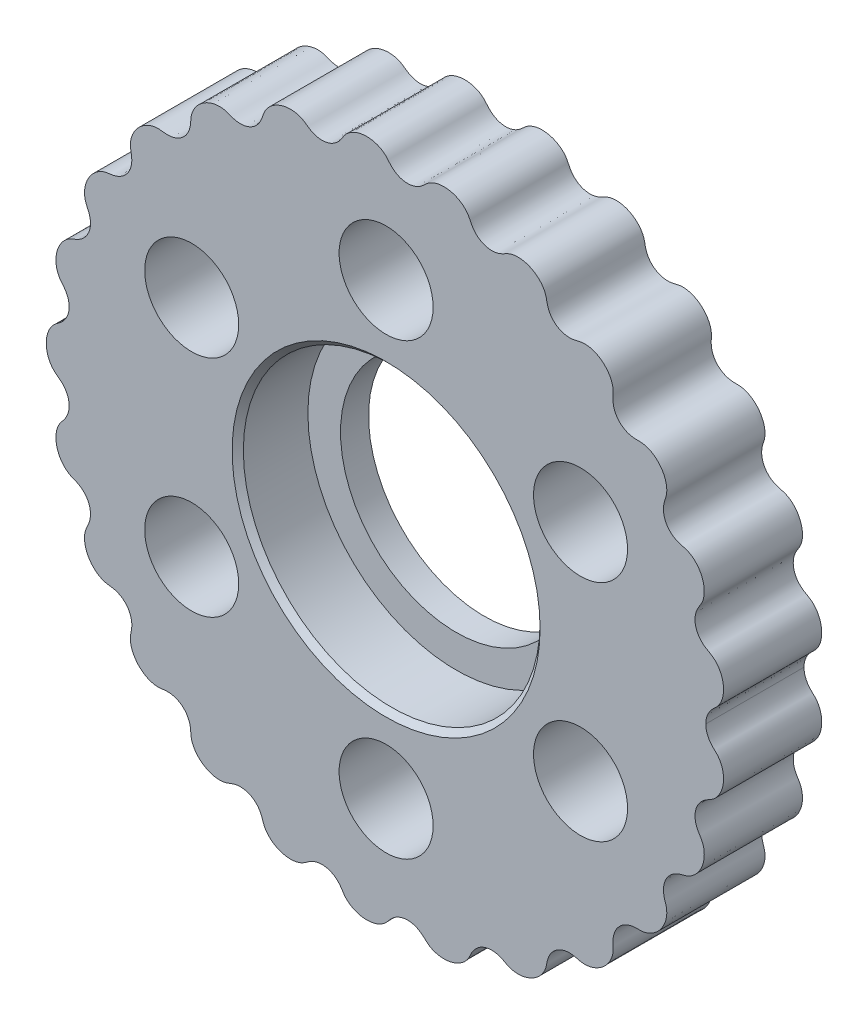
from build123d import *

# Parameters (mm, degrees)
BOSS_EXTRUDE2_OUTLINE_R   = 3.35
BOSS_EXTRUDE2_OUTLINE_R_2 = 8.25
BOSS_EXTRUDE2_DEPTH       = 7
SKETCH3_R                 = 10.575
CUT_EXTRUDE1_DEPTH        = 5
CHAMFER1_SIZE             = 0.4


# Read off the part's stored shape, not the designer's step: Boss-Extrude2
with BuildPart() as part:
    # Boss-Extrude2 outline → Boss-Extrude2 (new body)
    with BuildSketch(Plane.XY):
        with BuildLine():
            add(Edge.make_bspline(
                [(-24.22, 0), (-24.22, -0.018549196), (-24.219447299, -0.055631093), (-24.216960054, -0.12081441), (-24.210325897, -0.213487932), (-24.197882321, -0.323999799), (-24.176299834, -0.448982193), (-24.141395786, -0.595895603), (-24.088097077, -0.760122302), (-24.021284653, -0.918911553), (-23.94083921, -1.071476253), (-23.850156372, -1.210449232), (-23.750782771, -1.335175792), (-23.644418658, -1.445156499), (-23.532877519, -1.540026346), (-23.414565779, -1.626138769), (-23.295742191, -1.711436542), (-23.152646986, -1.82541348), (-22.967845238, -2.00358463), (-22.770766979, -2.270831102), (-22.61467742, -2.646713727), (-22.562902109, -3.087016939), (-22.626971537, -3.487565417), (-22.754815757, -3.791453025), (-22.891097081, -4.006933416), (-23.001901076, -4.151043768), (-23.095543837, -4.262219923), (-23.187445569, -4.374975056), (-23.269946813, -4.494784084), (-23.406247867, -4.740164684), (-23.53300629, -5.139768536), (-23.561700117, -5.698191268), (-23.386758438, -6.370571851), (-23.08963931, -6.844663095), (-22.783232826, -7.131342999), (-22.513168869, -7.298248762), (-22.313162523, -7.386218135), (-22.073134472, -7.471500821), (-21.778048031, -7.628259898), (-21.485035026, -7.865958292), (-21.237485622, -8.200285268), (-21.080759868, -8.62358006), (-21.049802486, -9.030968373), (-21.10243357, -9.354111964), (-21.183212319, -9.594182109), (-21.255573883, -9.75945739), (-21.318445407, -9.889381057), (-21.377949252, -10.020968458), (-21.426108106, -10.157164339), (-21.493710602, -10.427539308), (-21.513763193, -10.843420478), (-21.399915455, -11.390295219), (-21.102267605, -11.921886845), (-20.739385996, -12.297765819), (-20.415144238, -12.507692145), (-20.187923445, -12.608393522), (-19.997598517, -12.663680464), (-19.851881049, -12.690844938), (-19.704782383, -12.708389621), (-19.557874768, -12.727166257), (-19.375798661, -12.761217219), (-19.12514698, -12.834376848), (-18.821392565, -12.983928801), (-18.504883804, -13.253142477), (-18.255677763, -13.631335911), (-18.133312589, -14.023313646), (-18.110968987, -14.38890418), (-18.150097941, -14.710357198), (-18.216222015, -14.985193283), (-18.236712715, -15.281724635), (-18.197714574, -15.589639034), (-18.079407169, -15.979423518), (-17.869747332, -16.35091051), (-17.588251709, -16.675151517), (-17.245174502, -16.936765712), (-16.93557318, -17.10184519), (-16.649505418, -17.195443205), (-16.402439494, -17.234569713), (-16.203020578, -17.238662266), (-16.054339482, -17.227081449), (-15.906658236, -17.206886615), (-15.75867165, -17.189257805), (-15.572570565, -17.178637046), (-15.309989239, -17.1903718), (-14.977339407, -17.264917246), (-14.609384419, -17.451766877), (-14.284470124, -17.754814286), (-14.075231513, -18.097537161), (-13.964820751, -18.437303989), (-13.921748971, -18.754956982), (-13.917697603, -19.039689384), (-13.864404565, -19.334240426), (-13.749434711, -19.624864832), (-13.536523355, -19.975209385), (-13.240132232, -20.282910695), (-12.88771773, -20.525640252), (-12.493535044, -20.692228457), (-12.158712678, -20.774525308), (-11.862323107, -20.795520407), (-11.614686672, -20.774204172), (-11.419415062, -20.730290527), (-11.275199236, -20.682153953), (-11.134451159, -20.624861714), (-10.992971305, -20.569653368), (-10.811872967, -20.511706104), (-10.549107659, -20.456700486), (-10.199715261, -20.447491826), (-9.687556794, -20.567355209), (-9.25037612, -20.866339464), (-8.968827339, -21.252640531), (-8.814695671, -21.647404154), (-8.739465668, -21.920231231), (-8.611721283, -22.188801487), (-8.42738688, -22.438434035), (-8.133949594, -22.720870574), (-7.770071853, -22.943127422), (-7.366221207, -23.089260936), (-6.939032338, -23.150661023), (-6.587869488, -23.143846389), (-6.292381178, -23.085836661), (-6.057739899, -22.999115679), (-5.882069033, -22.905084999), (-5.758332763, -22.822538888), (-5.639078076, -22.733742645), (-5.517851091, -22.64774948), (-5.359585734, -22.549960212), (-5.118319749, -22.433035532), (-4.778223472, -22.33872334), (-4.244654046, -22.333064891), (-3.743968072, -22.525473928), (-3.380994126, -22.837472428), (-3.141942745, -23.180994421), (-3.005014863, -23.416642838), (-2.817421884, -23.63777599), (-2.580133042, -23.830851932), (-2.225963667, -24.030840774), (-1.747814609, -24.176595657), (-1.251961822, -24.202098476), (-0.771687178, -24.109125397), (-0.414489924, -23.958870166), (-0.161771104, -23.800119537), (0.050781503, -23.604208696), (0.218769388, -23.382667303), (0.498394334, -23.077063686), (0.893761638, -22.818281334), (1.407028151, -22.690961221), (1.92871029, -22.758151519), (2.256288171, -22.892453356), (2.482604783, -23.037782528), (2.628380604, -23.154295335), (2.738552876, -23.254753519), (2.845991601, -23.358186274), (2.958265856, -23.456441637), (3.120637218, -23.57299944), (3.342765564, -23.689815649), (3.629235302, -23.785703254), (3.977788991, -23.837563944), (4.409572456, -23.831034145), (4.82850544, -23.737573531), (5.216871718, -23.563921395), (5.543216012, -23.32245651), (5.757454793, -23.099530667), (5.919135345, -22.850999627), (6.02803793, -22.590749943), (6.22752105, -22.218605364), (6.553636474, -21.867329577), (7.02701751, -21.620425793), (7.552862402, -21.563982853), (7.900603849, -21.617256944), (8.1533003, -21.704275106), (8.321673277, -21.782033314), (8.452093648, -21.852347996), (8.581218988, -21.925143682), (8.714257717, -21.990651868), (8.90013323, -22.060683045), (9.14324341, -22.116039199), (9.442774436, -22.135445704), (9.790757825, -22.09739811), (10.206403733, -21.982191318), (10.588566468, -21.785708941), (10.921886357, -21.518268586), (11.177280688, -21.199328893), (11.3283947, -20.92698625), (11.419718838, -20.642985442), (11.459957802, -20.36193621), (11.566210556, -19.950075147), (11.799506653, -19.534359487), (12.194871241, -19.188375758), (12.68284706, -19.008667979), (13.023551629, -18.973847007), (13.286272703, -18.993605261), (13.470452069, -19.026687065), (13.615581608, -19.062393068), (13.759984567, -19.101224633), (13.906334643, -19.132197796), (14.105203931, -19.154274515), (14.356070472, -19.147504215), (14.652753438, -19.091339465), (14.981996718, -18.966817291), (15.353938748, -18.751955375), (15.672102472, -18.468978027), (15.925298997, -18.132406826), (16.093701913, -17.765521967), (16.174698894, -17.464991063), (16.195684783, -17.164174487), (16.163741926, -16.875740052), (16.163866972, -16.439881276), (16.291933693, -15.971398633), (16.598237157, -15.536522354), (17.034118674, -15.246088087), (17.354914106, -15.132998624), (17.613128579, -15.090218079), (17.798685621, -15.078314396), (17.947201674, -15.077706652), (18.095803014, -15.079006435), (18.244270559, -15.071093086), (18.440809704, -15.04107354), (18.679957605, -14.970443081), (18.950666989, -14.841236608), (19.235747663, -14.638525928), (19.543341384, -14.33470779), (19.8297987, -13.903911803), (19.983392332, -13.460501992), (20.017116459, -13.04696509), (19.985514577, -12.771061032), (19.955755619, -12.630218549), (19.913960824, -12.492520105), (19.867963993, -12.356265596), (19.81636544, -12.184030592), (19.76503016, -11.936940375), (19.750952131, -11.610801976), (19.829317521, -11.210537287), (20.034424804, -10.807989124), (20.320092443, -10.504847824), (20.609079397, -10.321805943), (20.85053307, -10.221856799), (21.024916919, -10.168328263), (21.166343012, -10.132703829), (21.307719173, -10.096549746), (21.446063213, -10.050068884), (21.703324104, -9.935007107), (22.045286112, -9.68904697), (22.401149752, -9.256576328), (22.660312503, -8.611717803), (22.703211517, -8.055135884), (22.629379774, -7.643875175), (22.526663265, -7.383733999), (22.460820885, -7.254575689), (22.384514656, -7.131346994), (22.30568153, -7.009834555), (22.213474652, -6.853938548), (22.10426648, -6.62451199), (22.013504565, -6.30870382), (21.996622733, -5.900127508), (22.102695807, -5.461383578), (22.309115562, -5.101414432), (22.545297228, -4.857298063), (22.754708048, -4.703878072), (22.910181412, -4.610573065), (23.037791561, -4.541742013), (23.164559665, -4.471195967), (23.285394077, -4.390851405), (23.50265665, -4.214216807), (23.768396846, -3.891074365), (24.002258872, -3.383866348), (24.079073491, -2.780895787), (24.012242541, -2.266002194), (23.880082348, -1.907843823), (23.760883417, -1.693318548), (23.6444806, -1.536244882), (23.546636266, -1.427917722), (23.440687726, -1.327636726), (23.333658759, -1.228607564), (23.205809889, -1.098580734), (23.078843694, -0.942768192), (22.977013553, -0.779743996), (22.900316676, -0.614098088), (22.854234188, -0.484795208), (22.824468983, -0.379786311), (22.801987234, -0.2744556), (22.786924397, -0.161897379), (22.781258991, -0.070575409), (22.78, -0.023577675), (22.78, 0)],
                knots=[0.069077773, 0.069077773, 0.069077773, 0.069077773, 0.069077773, 0.069947722, 0.070817672, 0.071687622, 0.072557572, 0.074297471, 0.076037371, 0.07777727, 0.07951717, 0.081257069, 0.082996969, 0.084474896, 0.085952824, 0.087430751, 0.088908678, 0.090386606, 0.091864533, 0.094820388, 0.09925974, 0.103699091, 0.108105886, 0.11251268, 0.115450198, 0.116918956, 0.118387715, 0.119856473, 0.121325232, 0.122793991, 0.124262749, 0.131176704, 0.138090659, 0.145012312, 0.151933966, 0.153403354, 0.154872742, 0.157811519, 0.160750295, 0.163689072, 0.168315415, 0.172941758, 0.177322078, 0.181702397, 0.184618838, 0.186077059, 0.187535279, 0.1889935, 0.19045172, 0.191909941, 0.193368161, 0.200235942, 0.207103723, 0.214117898, 0.217624986, 0.221132074, 0.222628415, 0.224124756, 0.225621096, 0.227117437, 0.228613778, 0.230110118, 0.2331028, 0.237643376, 0.242183952, 0.246677516, 0.25117108, 0.254023146, 0.256875212, 0.259727278, 0.262579345, 0.265963706, 0.269348067, 0.276116788, 0.279646578, 0.283176367, 0.286706156, 0.290235945, 0.291741606, 0.293247267, 0.294752928, 0.296258589, 0.29776425, 0.29926991, 0.302281232, 0.306853324, 0.311425416, 0.315720291, 0.320015165, 0.322888365, 0.325761565, 0.328634765, 0.331507964, 0.334913392, 0.33831882, 0.345129676, 0.348598999, 0.352068322, 0.355537646, 0.359006969, 0.360541804, 0.36207664, 0.363611475, 0.365146311, 0.366681146, 0.368215982, 0.371285653, 0.375975692, 0.380665732, 0.389194987, 0.392049231, 0.394903475, 0.397757719, 0.400611963, 0.403994631, 0.4073773, 0.414142636, 0.417675708, 0.42120878, 0.424741852, 0.428274924, 0.429776811, 0.431278698, 0.432780586, 0.434282473, 0.43578436, 0.437286247, 0.440290022, 0.445097402, 0.449904782, 0.458550476, 0.461299252, 0.464048029, 0.466796805, 0.469545582, 0.472948127, 0.476350673, 0.483155764, 0.489551347, 0.492749139, 0.49594693, 0.49875113, 0.50155533, 0.50435953, 0.50716373, 0.515462993, 0.520285406, 0.525107819, 0.528120865, 0.529627388, 0.531133911, 0.532640434, 0.534146957, 0.53565348, 0.537160003, 0.540704391, 0.544248779, 0.547793167, 0.551337555, 0.558080044, 0.561451288, 0.564822533, 0.567667546, 0.570512559, 0.573357571, 0.576202584, 0.584701263, 0.589493508, 0.594285754, 0.597280306, 0.598777582, 0.600274859, 0.601772135, 0.603269411, 0.604766687, 0.606263964, 0.60978562, 0.613307276, 0.616828933, 0.620350589, 0.627138717, 0.630532782, 0.633926846, 0.636790488, 0.639654129, 0.642517771, 0.645381413, 0.653941022, 0.658528672, 0.663116322, 0.666137122, 0.667647521, 0.669157921, 0.670668321, 0.672178721, 0.67368912, 0.67519952, 0.678740508, 0.682281496, 0.685822484, 0.689363472, 0.696022465, 0.699351962, 0.702681458, 0.705607729, 0.708534, 0.711460271, 0.714386541, 0.723181903, 0.727738304, 0.732294704, 0.735296652, 0.736797625, 0.738298599, 0.739799573, 0.741300546, 0.74280152, 0.744302494, 0.747820982, 0.75133947, 0.754857958, 0.758376445, 0.765220964, 0.772065482, 0.773518459, 0.774971437, 0.776424414, 0.777877391, 0.779330369, 0.780783346, 0.783689301, 0.788056529, 0.792423757, 0.797067025, 0.801710293, 0.804657596, 0.806131247, 0.807604899, 0.80907855, 0.810552202, 0.812025854, 0.813499505, 0.820444506, 0.827389507, 0.834280436, 0.841171366, 0.842634884, 0.844098403, 0.845561921, 0.84702544, 0.848488958, 0.849952477, 0.852879514, 0.857272875, 0.861666236, 0.866275507, 0.870884777, 0.873814777, 0.875279777, 0.876744777, 0.878209777, 0.879674777, 0.881139777, 0.882604777, 0.889503673, 0.896402569, 0.903339417, 0.906807841, 0.910276264, 0.911749575, 0.913222885, 0.914696195, 0.916169505, 0.917642815, 0.919116126, 0.922062746, 0.924274313, 0.925380096, 0.92648588, 0.927591663, 0.928697446, 0.92980323, 0.930909013, 0.930909013, 0.930909013, 0.930909013, 0.930909013], degree=4))
            add(Edge.make_bspline(
                [(22.78, 0), (22.78, 0.011788838), (22.780314749, 0.035502688), (22.781731106, 0.076509963), (22.785505254, 0.135473486), (22.792573008, 0.206038602), (22.804797658, 0.285774525), (22.824467981, 0.379531373), (22.854236356, 0.485170134), (22.900312372, 0.613964918), (22.977023325, 0.77979384), (23.078825905, 0.942766565), (23.205839603, 1.098545128), (23.333634687, 1.228656662), (23.440629098, 1.327686413), (23.546726131, 1.427803175), (23.644449785, 1.536290512), (23.760891492, 1.693306709), (23.880077692, 1.907847427), (24.012247527, 2.266002298), (24.079067136, 2.780891982), (24.002268665, 3.383875495), (23.768385035, 3.891060688), (23.502670102, 4.214235612), (23.285371375, 4.390811541), (23.164625106, 4.471307603), (23.037738709, 4.541696012), (22.910177975, 4.610512829), (22.754714776, 4.703915141), (22.545294502, 4.857275391), (22.309115579, 5.101431249), (22.102698357, 5.461370584), (21.996617293, 5.900139936), (22.0135147, 6.308688494), (22.104249292, 6.624533194), (22.213507781, 6.853901404), (22.305631416, 7.009901152), (22.384469105, 7.131339214), (22.460933264, 7.254513907), (22.526621015, 7.383759503), (22.629402843, 7.643861925), (22.703194156, 8.055147399), (22.660322715, 8.611706519), (22.401145561, 9.256588641), (22.045284473, 9.689032191), (21.703329043, 9.935025827), (21.446053318, 10.050027634), (21.3077535, 10.096684111), (21.166299396, 10.132606815), (21.024933481, 10.168298687), (20.850528057, 10.221884743), (20.609083858, 10.321788394), (20.320087189, 10.504860859), (20.034431347, 10.807979297), (19.829308378, 11.210546349), (19.750966778, 11.610791121), (19.765006377, 11.936955327), (19.816412166, 12.184003328), (19.867874099, 12.356324961), (19.913962066, 12.492483765), (19.955859135, 12.630196462), (19.98546863, 12.771073715), (20.017144531, 13.046959365), (19.98336635, 13.460505537), (19.829815883, 13.903910966), (19.543332796, 14.334706685), (19.23575249, 14.638528903), (18.950663354, 14.841229828), (18.679960115, 14.970452633), (18.440806166, 15.04106199), (18.244281736, 15.071073941), (18.095774528, 15.079150553), (17.947225277, 15.077555571), (17.798654784, 15.078345654), (17.613206514, 15.090201316), (17.354773585, 15.133036393), (17.034347981, 15.246022146), (16.689602504, 15.475530495), (16.399981775, 15.818415405), (16.231829046, 16.189946273), (16.164196631, 16.548844988), (16.163431333, 16.875824418), (16.1958915, 17.164119055), (16.174576447, 17.465025364), (16.093767809, 17.765502905), (15.925242709, 18.132422499), (15.672140553, 18.46896897), (15.353917234, 18.751957909), (14.982006718, 18.966819943), (14.652749423, 19.091329604), (14.356069083, 19.147520328), (14.105208051, 19.1542509), (13.906342915, 19.132201216), (13.759927431, 19.101333197), (13.615649191, 19.062246972), (13.470404068, 19.026726211), (13.286360067, 18.993601328), (13.023396743, 18.973851457), (12.683099797, 19.008661318), (12.295155061, 19.151329038), (11.937022158, 19.414364266), (11.689475746, 19.729676564), (11.540087077, 20.052846138), (11.459615283, 20.361937775), (11.419949452, 20.642984369), (11.328260174, 20.926988594), (11.177353088, 21.199326923), (10.921827252, 21.518269711), (10.588605406, 21.785709408), (10.20638271, 21.982189009), (9.790766232, 22.097402216), (9.442774074, 22.135437025), (9.143237366, 22.116051685), (8.900143935, 22.060665314), (8.714262887, 21.990650855), (8.581151286, 21.925238987), (8.452161083, 21.852217714), (8.32167887, 21.782068117), (8.153284552, 21.704269882), (7.900619324, 21.617261425), (7.552845832, 21.563977773), (7.027041632, 21.620433966), (6.553604126, 21.867317998), (6.227565458, 22.218621379), (6.027976046, 22.590728313), (5.919209729, 22.851022936), (5.75740646, 23.09951713), (5.543241097, 23.3224632), (5.21685252, 23.563915287), (4.828516316, 23.737579086), (4.409569317, 23.83102858), (3.977786072, 23.837570132), (3.629246427, 23.785692367), (3.342747509, 23.689830805), (3.120663439, 23.572976666), (2.958254225, 23.456456883), (2.845922534, 23.358239395), (2.738654298, 23.25464893), (2.628362912, 23.154337822), (2.482597715, 23.037769763), (2.256297892, 22.892463673), (1.928698001, 22.758141295), (1.407047224, 22.690975813), (0.89373513, 22.818262022), (0.49843177, 23.077089852), (0.218715244, 23.38263125), (0.050843029, 23.604245849), (-0.161813442, 23.800096965), (-0.414467111, 23.958880045), (-0.771706921, 24.109119275), (-1.251940953, 24.202101308), (-1.747836163, 24.176596922), (-2.225942084, 24.030836103), (-2.580158028, 23.830859991), (-2.817376903, 23.637757983), (-3.005078649, 23.416672029), (-3.141885623, 23.180965384), (-3.381034925, 22.837493981), (-3.743938637, 22.5254581), (-4.244675676, 22.333076498), (-4.778209021, 22.338715623), (-5.118332663, 22.433043083), (-5.359573745, 22.549950875), (-5.517845804, 22.647789338), (-5.639163503, 22.733623532), (-5.758262398, 22.82261295), (-5.882066293, 22.905093081), (-6.057759026, 22.999094605), (-6.292367392, 23.085851031), (-6.587877969, 23.143836223), (-6.93903043, 23.150666378), (-7.366217864, 23.089256815), (-7.770082111, 22.943130622), (-8.133931713, 22.720867861), (-8.427410461, 22.438436661), (-8.611674455, 22.188795287), (-8.739539913, 21.920243727), (-8.814631849, 21.64739126), (-8.968874399, 21.252650247), (-9.250341052, 20.866332727), (-9.687583596, 20.567359353), (-10.199695857, 20.447489958), (-10.549127869, 20.456701101), (-10.811849282, 20.511706452), (-10.99298852, 20.569684129), (-11.134496222, 20.624719852), (-11.275138476, 20.682279), (-11.419428546, 20.730268096), (-11.614690037, 20.774198482), (-11.862319652, 20.795525505), (-12.158714195, 20.774521643), (-12.493536544, 20.692229849), (-12.887712066, 20.525640266), (-13.240143962, 20.282908978), (-13.536504556, 19.975212759), (-13.749459069, 19.624860499), (-13.864354787, 19.334247305), (-13.917781686, 19.03968137), (-13.92166162, 18.754961956), (-13.964871074, 18.437302295), (-14.075200888, 18.097537597), (-14.284489946, 17.754814515), (-14.609371192, 17.45176603), (-14.977348186, 17.264918897), (-15.309984495, 17.190369612), (-15.572571936, 17.178639713), (-15.758667665, 17.189288363), (-15.90669389, 17.206737145), (-16.054296685, 17.227208967), (-16.20303043, 17.238654896), (-16.402440757, 17.234551233), (-16.64950379, 17.195456941), (-16.935573139, 17.101835933), (-17.245176873, 16.936769349), (-17.588245396, 16.675151123), (-17.869759461, 16.350906953), (-18.079388388, 15.979431043), (-18.197737474, 15.589629288), (-18.236665991, 15.281743064), (-18.21629975, 14.985166056), (-18.150016409, 14.710382207), (-18.111017664, 14.388890655), (-18.133282219, 14.023320939), (-18.255697504, 13.631332539), (-18.504870705, 13.253142734), (-18.821401423, 12.98393189), (-19.125141907, 12.834370113), (-19.375800435, 12.761229426), (-19.557879876, 12.727175092), (-19.704776023, 12.708249977), (-19.851874552, 12.690997222), (-19.997605245, 12.663652709), (-20.187921244, 12.608387467), (-20.415143068, 12.507697755), (-20.739390283, 12.297760201), (-21.102259264, 11.921892433), (-21.399930819, 11.39028823), (-21.513742764, 10.843428092), (-21.493735534, 10.427529854), (-21.426064186, 10.157183317), (-21.378058016, 10.020927967), (-21.318422074, 9.889353063), (-21.255505749, 9.759532902), (-21.183245449, 9.5941251), (-21.102426037, 9.35417193), (-21.049792643, 9.030886154), (-21.080786144, 8.623693714), (-21.237438134, 8.200115183), (-21.48511436, 7.866222761), (-21.749480491, 7.650981948), (-21.976502265, 7.523346987), (-22.14264464, 7.449252189), (-22.278137268, 7.396562523), (-22.413421048, 7.342927019), (-22.544052562, 7.278747251), (-22.783314369, 7.131582107), (-23.089581003, 6.844468428), (-23.386779124, 6.37069817), (-23.539861082, 5.782149579), (-23.539324421, 5.263558125), (-23.454642248, 4.892615439), (-23.364583091, 4.665177176), (-23.269940606, 4.494853195), (-23.187529867, 4.374864232), (-23.095494765, 4.262248048), (-23.001865612, 4.151101009), (-22.891124087, 4.006896815), (-22.754801609, 3.7914741), (-22.626979666, 3.487550223), (-22.562898301, 3.087028874), (-22.614678245, 2.646701775), (-22.77076921, 2.270846278), (-22.967839379, 2.003563886), (-23.152659179, 1.825448341), (-23.295735426, 1.711396374), (-23.414506334, 1.626067685), (-23.532948732, 1.540151117), (-23.644400388, 1.445115879), (-23.750777682, 1.335161776), (-23.850160104, 1.2104794), (-23.940836606, 1.071419346), (-24.021286041, 0.919026015), (-24.0880965, 0.759872545), (-24.141396004, 0.596315967), (-24.176299705, 0.448960704), (-24.197882444, 0.322007353), (-24.210326134, 0.216806144), (-24.216958264, 0.124082101), (-24.219447309, 0.056324213), (-24.22, 0.018549195), (-24.22, 0)],
                knots=[0.069090958, 0.069090958, 0.069090958, 0.069090958, 0.069090958, 0.06964385, 0.070196742, 0.070749633, 0.071302525, 0.072408309, 0.073514092, 0.074619875, 0.075725659, 0.077937226, 0.080883846, 0.082357156, 0.083830467, 0.085303777, 0.086777087, 0.088250397, 0.089723708, 0.093192132, 0.096660555, 0.103597403, 0.1104963, 0.117395196, 0.118860196, 0.120325196, 0.121790196, 0.123255196, 0.124720196, 0.126185196, 0.129115196, 0.133724467, 0.138333738, 0.142727099, 0.14712046, 0.150047497, 0.151511016, 0.152974534, 0.154438053, 0.155901571, 0.15736509, 0.158828608, 0.165719538, 0.172610468, 0.179555469, 0.18650047, 0.187974122, 0.189447773, 0.190921425, 0.192395076, 0.193868728, 0.195342379, 0.198289683, 0.202932951, 0.207576218, 0.211943447, 0.216310675, 0.21921663, 0.220669607, 0.222122585, 0.223575562, 0.22502854, 0.226481517, 0.227934495, 0.234779013, 0.241623531, 0.245142019, 0.248660507, 0.252178995, 0.255697483, 0.257198457, 0.258699431, 0.260200405, 0.261701378, 0.263202352, 0.264703326, 0.267705273, 0.272261674, 0.276818074, 0.281215756, 0.285613437, 0.288539708, 0.291465978, 0.294392249, 0.29731852, 0.300648017, 0.303977513, 0.310636507, 0.314177495, 0.317718483, 0.321259471, 0.324800459, 0.326310859, 0.327821259, 0.329331659, 0.330842058, 0.332352458, 0.333862858, 0.336883658, 0.341471308, 0.346058958, 0.350338763, 0.354618567, 0.357482209, 0.360345851, 0.363209493, 0.366073135, 0.369467199, 0.372861263, 0.379649392, 0.383171048, 0.386692705, 0.390214361, 0.393736018, 0.395233294, 0.39673057, 0.398227847, 0.399725123, 0.401222399, 0.402719676, 0.405714228, 0.410506473, 0.415298719, 0.423797398, 0.426642411, 0.429487424, 0.432332437, 0.43517745, 0.438548695, 0.441919939, 0.448662429, 0.452206817, 0.455751205, 0.459295593, 0.462839981, 0.464346504, 0.465853027, 0.46735955, 0.468866073, 0.470372596, 0.471879119, 0.474892165, 0.479714578, 0.484536991, 0.492836254, 0.495640454, 0.498444654, 0.501248854, 0.504053054, 0.507250846, 0.510448638, 0.516844221, 0.523649313, 0.527051858, 0.530454404, 0.53320318, 0.535951957, 0.538700734, 0.54144951, 0.550095204, 0.554902584, 0.559709965, 0.562713739, 0.564215627, 0.565717514, 0.567219401, 0.568721288, 0.570223176, 0.571725063, 0.575258135, 0.578791207, 0.582324279, 0.585857351, 0.592622688, 0.596005356, 0.599388024, 0.602242268, 0.605096512, 0.607950757, 0.610805001, 0.619334256, 0.624024296, 0.628714336, 0.631784007, 0.633318842, 0.634853678, 0.636388513, 0.637923349, 0.639458184, 0.64099302, 0.644462343, 0.647931667, 0.65140099, 0.654870314, 0.66168117, 0.665086598, 0.668492025, 0.671365225, 0.674238425, 0.677111625, 0.679984825, 0.6842797, 0.688574574, 0.693146667, 0.697718759, 0.70073008, 0.702235741, 0.703741402, 0.705247063, 0.706752724, 0.708258385, 0.709764046, 0.713293835, 0.716823624, 0.720353414, 0.723883203, 0.730651925, 0.734036286, 0.737420647, 0.740272714, 0.74312478, 0.745976846, 0.748828913, 0.753322476, 0.75781604, 0.762356617, 0.766897193, 0.769889875, 0.771386215, 0.772882556, 0.774378897, 0.775875237, 0.777371578, 0.778867919, 0.782375007, 0.785882095, 0.792896271, 0.799764052, 0.806631833, 0.808090053, 0.809548274, 0.811006494, 0.812464715, 0.813922935, 0.815381156, 0.818297597, 0.822677917, 0.827058237, 0.83168458, 0.836310923, 0.8392497, 0.840719088, 0.842188477, 0.843657865, 0.845127253, 0.846596642, 0.84806603, 0.854987683, 0.861909337, 0.868823292, 0.872280269, 0.875737247, 0.877206006, 0.878674764, 0.880143523, 0.881612282, 0.88308104, 0.884549799, 0.887487316, 0.891894111, 0.896300906, 0.900740257, 0.905179609, 0.908135464, 0.909613391, 0.911091319, 0.912569246, 0.914047174, 0.915525101, 0.917003029, 0.918742928, 0.920482828, 0.922222727, 0.923962627, 0.925702526, 0.927442426, 0.928312376, 0.929182326, 0.930052275, 0.930922225, 0.930922225, 0.930922225, 0.930922225, 0.930922225], degree=4))
        make_face()
        with Locations((-13.856406461, -8)):
            Circle(BOSS_EXTRUDE2_OUTLINE_R, mode=Mode.SUBTRACT)
        with Locations((0, -16)):
            Circle(BOSS_EXTRUDE2_OUTLINE_R, mode=Mode.SUBTRACT)
        Circle(BOSS_EXTRUDE2_OUTLINE_R_2, mode=Mode.SUBTRACT)
        with Locations((13.856406461, -8)):
            Circle(BOSS_EXTRUDE2_OUTLINE_R, mode=Mode.SUBTRACT)
        with Locations((-13.856406461, 8)):
            Circle(BOSS_EXTRUDE2_OUTLINE_R, mode=Mode.SUBTRACT)
        with Locations((13.856406461, 8)):
            Circle(BOSS_EXTRUDE2_OUTLINE_R, mode=Mode.SUBTRACT)
        with Locations((0, 16)):
            Circle(BOSS_EXTRUDE2_OUTLINE_R, mode=Mode.SUBTRACT)
    extrude(amount=BOSS_EXTRUDE2_DEPTH)

    # Sketch3 → Cut-Extrude1 (cut)
    with BuildSketch(Plane.XY.offset(7)):
        Circle(SKETCH3_R)
    extrude(amount=-CUT_EXTRUDE1_DEPTH, mode=Mode.SUBTRACT)

    # Chamfer1
    chamfer1_edges = [part.edges().sort_by_distance(p)[0] for p in [
        (-10.575, 0, 7),
    ]]
    chamfer(chamfer1_edges, length=CHAMFER1_SIZE)


solid = part.part
